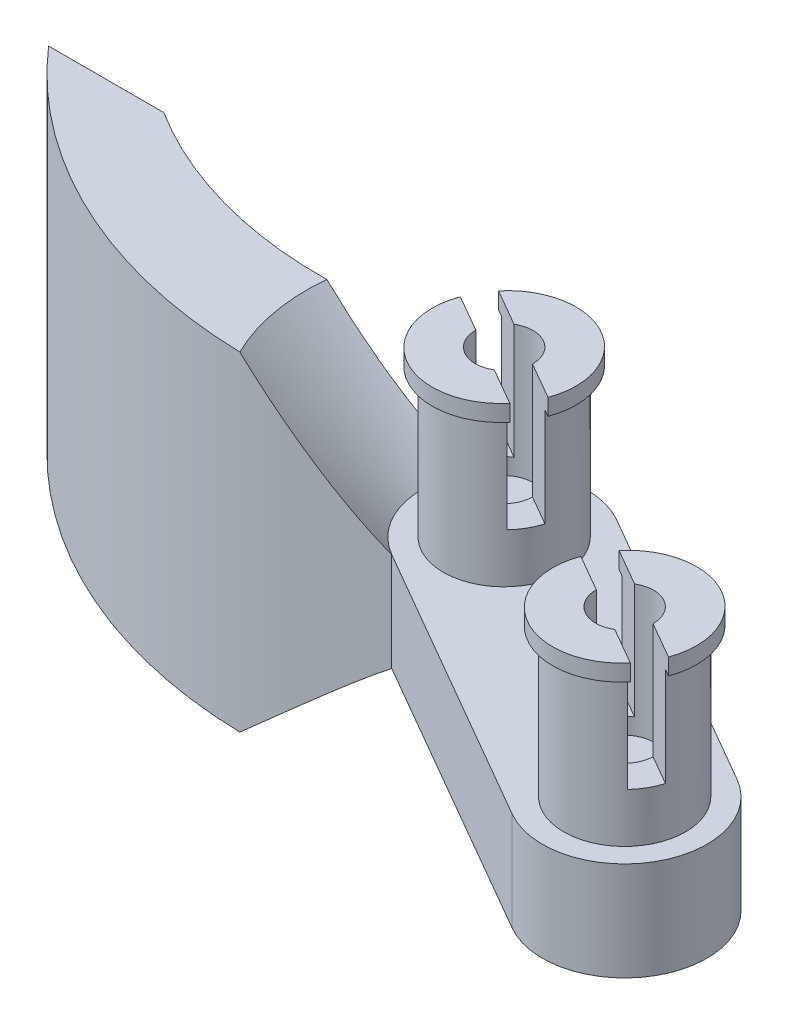
from build123d import *

# Parameters (mm, degrees)
BOSS_EXTRUDE1_DEPTH      = 6
BOSS_EXTRUDE2_DEPTH      = 13
BOSS_EXTRUDE2_DEPTH_BACK = 7
SKETCH1_5_R              = 3.7
SKETCH1_5_R_2            = 1.75
BOSS_EXTRUDE3_DEPTH      = 15
CHAMFER2_SIZE            = 7
CUT_EXTRUDE1_START       = -6
CUT_EXTRUDE1_DEPTH       = 6
SKETCH4_R                = 1.75
BOSS_EXTRUDE5_DEPTH      = 2
BOSS_EXTRUDE6_DEPTH      = 1


with BuildPart() as part:
    # Sketch1 → Boss-Extrude1 (new body)
    with BuildSketch(Plane(origin=(0, 0, 0), x_dir=(1, 0, 0), z_dir=(0, 1, 0))):
        with BuildLine():
            Line((-19.820508076, 5.669872981), (-2.5, -4.330127019))
            ThreePointArc((-2.5, -4.330127019), (4.330127019, -2.5), (2.5, 4.330127019))
            Line((2.5, 4.330127019), (-14.820508076, 14.330127019))
            ThreePointArc((-14.820508076, 14.330127019), (-14.879132605, 14.36276697), (-14.937615699, 14.395659668))
            ThreePointArc((-14.937615699, 14.395659668), (-21.683794323, 12.441666055), (-19.820508076, 5.669872981))
        make_face()
    extrude(amount=BOSS_EXTRUDE1_DEPTH)

    # Sketch1<4> → Boss-Extrude2 (add, two sides: drawn at the far end of the back side and taken through both)
    with BuildSketch(Plane(origin=(0, 0, 0), x_dir=(1, 0, 0), z_dir=(0, 1, 0)).offset(-BOSS_EXTRUDE2_DEPTH_BACK)):
        with BuildLine():
            ThreePointArc((-50, 15), (-36.237721473, 6.041072894), (-19.820508076, 5.669872981))
            ThreePointArc((-19.820508076, 5.669872981), (-22.150137207, 8.705904774), (-21.650635095, 12.5))
            ThreePointArc((-21.650635095, 12.5), (-32.607722458, 11.338333803), (-43, 15))
            Line((-43, 15), (-50, 15))
        make_face()
    extrude(amount=BOSS_EXTRUDE2_DEPTH + BOSS_EXTRUDE2_DEPTH_BACK)

    # Sketch1<5> → Boss-Extrude3 (add)
    # profile 1 of 5: a face of its own
    with BuildSketch(Plane(origin=(0, 0, 0), x_dir=(1, 0, 0), z_dir=(0, 1, 0))):
        with Locations(Location((0, 0, 0), (0, 0, 270))):
            Circle(SKETCH1_5_R)
        with Locations(Location((0, 0, 0), (0, 0, 270))):
            Circle(SKETCH1_5_R_2, mode=Mode.SUBTRACT)
    # profile 2 of 5: a face of its own
    with BuildSketch(Plane(origin=(0, 0, 0), x_dir=(1, 0, 0), z_dir=(0, 1, 0))):
        with BuildLine():
            ThreePointArc((-15.470508076, 13.204293994), (-20.52480207, 11.85), (-19.170508076, 6.795706006))
            Line((-19.170508076, 6.795706006), (-18.195508076, 8.484455543))
            ThreePointArc((-18.195508076, 8.484455543), (-18.836052532, 10.875), (-16.445508076, 11.515544457))
            Line((-16.445508076, 11.515544457), (-15.470508076, 13.204293994))
        make_face()
    # profile 3 of 5: a face of its own
    with BuildSketch(Plane(origin=(0, 0, 0), x_dir=(1, 0, 0), z_dir=(0, 1, 0))):
        with BuildLine():
            Line((-18.195508076, 8.484455543), (-19.170508076, 6.795706006))
            ThreePointArc((-19.170508076, 6.795706006), (-15.470508076, 6.795706006), (-13.620508076, 10))
            ThreePointArc((-13.620508076, 10), (-14.116214082, 11.85), (-15.470508076, 13.204293994))
            Line((-15.470508076, 13.204293994), (-16.445508076, 11.515544457))
            ThreePointArc((-16.445508076, 11.515544457), (-15.804963619, 10.875), (-15.570508076, 10))
            ThreePointArc((-15.570508076, 10), (-16.445508076, 8.484455543), (-18.195508076, 8.484455543))
        make_face()
    # profile 4 of 5: a face of its own
    with BuildSketch(Plane(origin=(0, 0, 0), x_dir=(1, 0, 0), z_dir=(0, 1, 0))):
        with BuildLine():
            ThreePointArc((-15.470508076, 13.204293994), (-20.52480207, 11.85), (-19.170508076, 6.795706006))
            Line((-19.170508076, 6.795706006), (-18.195508076, 8.484455543))
            ThreePointArc((-18.195508076, 8.484455543), (-18.836052532, 10.875), (-16.445508076, 11.515544457))
            Line((-16.445508076, 11.515544457), (-15.470508076, 13.204293994))
        make_face()
    # profile 5 of 5: a face of its own
    with BuildSketch(Plane(origin=(0, 0, 0), x_dir=(1, 0, 0), z_dir=(0, 1, 0))):
        with BuildLine():
            Line((-18.195508076, 8.484455543), (-19.170508076, 6.795706006))
            ThreePointArc((-19.170508076, 6.795706006), (-15.470508076, 6.795706006), (-13.620508076, 10))
            ThreePointArc((-13.620508076, 10), (-14.116214082, 11.85), (-15.470508076, 13.204293994))
            Line((-15.470508076, 13.204293994), (-16.445508076, 11.515544457))
            ThreePointArc((-16.445508076, 11.515544457), (-15.804963619, 10.875), (-15.570508076, 10))
            ThreePointArc((-15.570508076, 10), (-16.445508076, 8.484455543), (-18.195508076, 8.484455543))
        make_face()
    extrude(amount=BOSS_EXTRUDE3_DEPTH)

    # Chamfer2
    chamfer2_edges = [part.edges().sort_by_distance(p)[0] for p in [
        (-22.150137207, -7, -8.705904774),
        (-22.150137207, 13, -8.705904774),
    ]]
    chamfer(chamfer2_edges, length=CHAMFER2_SIZE - 0.0001)  # a hair under: the kernel refuses the full size

    # Sketch3 → Cut-Extrude1 (cut)
    with BuildSketch(Plane(origin=(0, 15, 0), x_dir=(1, 0, 0), z_dir=(0, 1, 0)).offset(CUT_EXTRUDE1_START)):
        with BuildLine():
            Line((-20.014101509, 12.536642351), (-18.220272206, 11.50097452))
            ThreePointArc((-18.220272206, 11.50097452), (-18.836052532, 10.875), (-19.070272206, 10.028731334))
            Line((-19.070272206, 10.028731334), (-20.864101509, 11.064399165))
            ThreePointArc((-20.864101509, 11.064399165), (-20.52480207, 11.85), (-20.014101509, 12.536642351))
        make_face()
        with BuildLine():
            Line((-13.776914643, 8.935600835), (-15.570743946, 9.971268666))
            ThreePointArc((-15.570743946, 9.971268666), (-15.804963619, 9.125), (-16.420743946, 8.49902548))
            Line((-16.420743946, 8.49902548), (-14.626914643, 7.463357649))
            ThreePointArc((-14.626914643, 7.463357649), (-14.116214082, 8.15), (-13.776914643, 8.935600835))
        make_face()
        with BuildLine():
            Line((2.693593433, -2.536642351), (0.89976413, -1.50097452))
            ThreePointArc((0.89976413, -1.50097452), (1.515544457, -0.875), (1.74976413, -0.028731334))
            Line((1.74976413, -0.028731334), (3.543593433, -1.064399165))
            ThreePointArc((3.543593433, -1.064399165), (3.204293994, -1.85), (2.693593433, -2.536642351))
        make_face()
        with BuildLine():
            Line((-3.543593433, 1.064399165), (-1.74976413, 0.028731334))
            ThreePointArc((-1.74976413, 0.028731334), (-1.515544457, 0.875), (-0.89976413, 1.50097452))
            Line((-0.89976413, 1.50097452), (-2.693593433, 2.536642351))
            ThreePointArc((-2.693593433, 2.536642351), (-3.204293994, 1.85), (-3.543593433, 1.064399165))
        make_face()
    extrude(amount=CUT_EXTRUDE1_DEPTH, mode=Mode.SUBTRACT)

    # Sketch4 → Boss-Extrude5 (add)
    with BuildSketch(Plane(origin=(0, 6, 0), x_dir=(1, 0, 0), z_dir=(0, 1, 0))):
        with Locations(Location((-17.320508076, 10, 0), (0, 0, 120.940718932))):
            Circle(SKETCH4_R)
        with Locations(Location((0, 0, 0), (0, 0, 90))):
            Circle(SKETCH4_R)
    extrude(amount=BOSS_EXTRUDE5_DEPTH)

    # Sketch6 → Boss-Extrude6 (add)
    with BuildSketch(Plane(origin=(0, 15, 0), x_dir=(1, 0, 0), z_dir=(0, 1, 0))):
        with BuildLine():
            Line((-18.220272206, 11.50097452), (-20.447114211, 12.786642351))
            ThreePointArc((-20.447114211, 12.786642351), (-15.161973233, 13.738692017), (-13.343901941, 8.685600835))
            Line((-13.343901941, 8.685600835), (-15.570743946, 9.971268666))
            ThreePointArc((-15.570743946, 9.971268666), (-16.445508076, 11.515544457), (-18.220272206, 11.50097452))
        make_face()
        with BuildLine():
            Line((-16.420743946, 8.49902548), (-14.193901941, 7.213357649))
            ThreePointArc((-14.193901941, 7.213357649), (-19.479042918, 6.261307983), (-21.297114211, 11.314399165))
            Line((-21.297114211, 11.314399165), (-19.070272206, 10.028731334))
            ThreePointArc((-19.070272206, 10.028731334), (-18.195508076, 8.484455543), (-16.420743946, 8.49902548))
        make_face()
        with BuildLine():
            Line((0.89976413, -1.50097452), (3.126606135, -2.786642351))
            ThreePointArc((3.126606135, -2.786642351), (-2.158534843, -3.738692017), (-3.976606135, 1.314399165))
            Line((-3.976606135, 1.314399165), (-1.74976413, 0.028731334))
            ThreePointArc((-1.74976413, 0.028731334), (-0.875, -1.515544457), (0.89976413, -1.50097452))
        make_face()
        with BuildLine():
            Line((-0.89976413, 1.50097452), (-3.126606135, 2.786642351))
            ThreePointArc((-3.126606135, 2.786642351), (2.158534843, 3.738692017), (3.976606135, -1.314399165))
            Line((3.976606135, -1.314399165), (1.74976413, -0.028731334))
            ThreePointArc((1.74976413, -0.028731334), (0.875, 1.515544457), (-0.89976413, 1.50097452))
        make_face()
    extrude(amount=BOSS_EXTRUDE6_DEPTH)


solid = part.part
